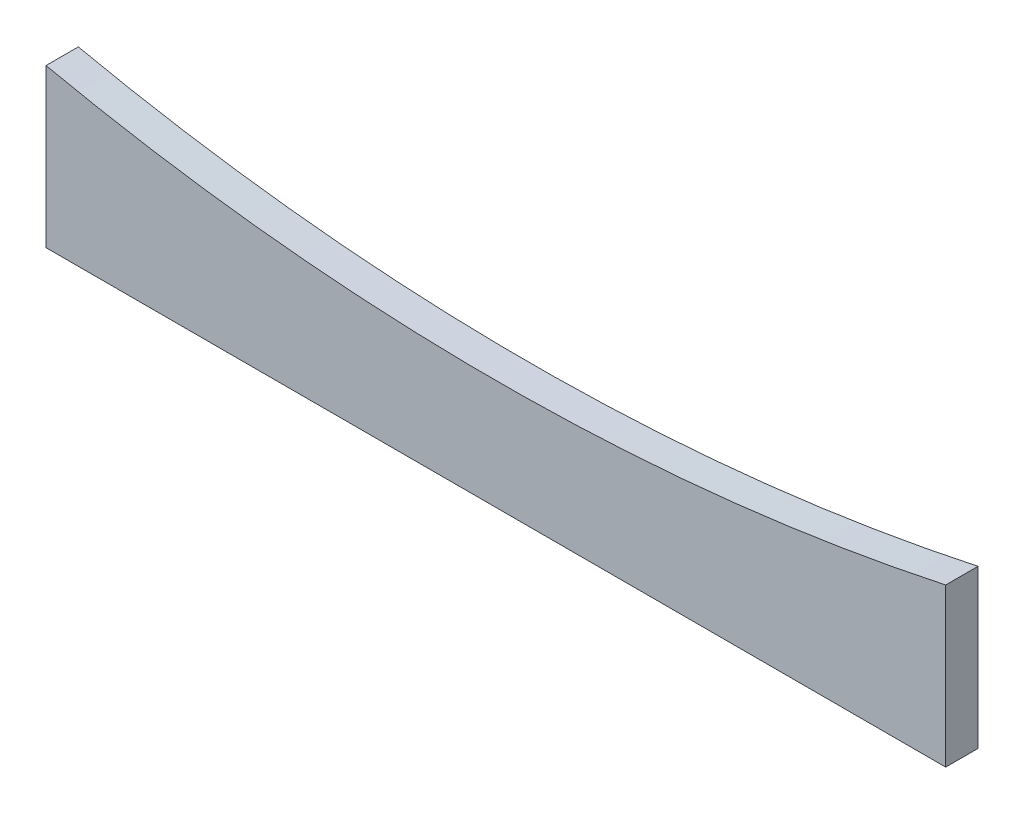
from build123d import *

# Parameters (mm, degrees)
BRIDA_BASE1_DEPTH = 6.35


# Sheet-metal steps are written as plain solids
with BuildPart() as part:
    # Croquis1 → Brida base1 (new body)
    with BuildSketch(Plane.XY):
        with BuildLine():
            Line((-54.677814402, 18.66153404), (-54.677814402, -12.33846596))
            Line((-54.677814402, -12.33846596), (122.122185598, -12.33846596))
            Line((122.122185598, -12.33846596), (122.122185598, 18.66153404))
            ThreePointArc((122.122185598, 18.66153404), (33.722185598, 9.253107261), (-54.677814402, 18.66153404))
        make_face()
    extrude(amount=-BRIDA_BASE1_DEPTH)


solid = part.part
